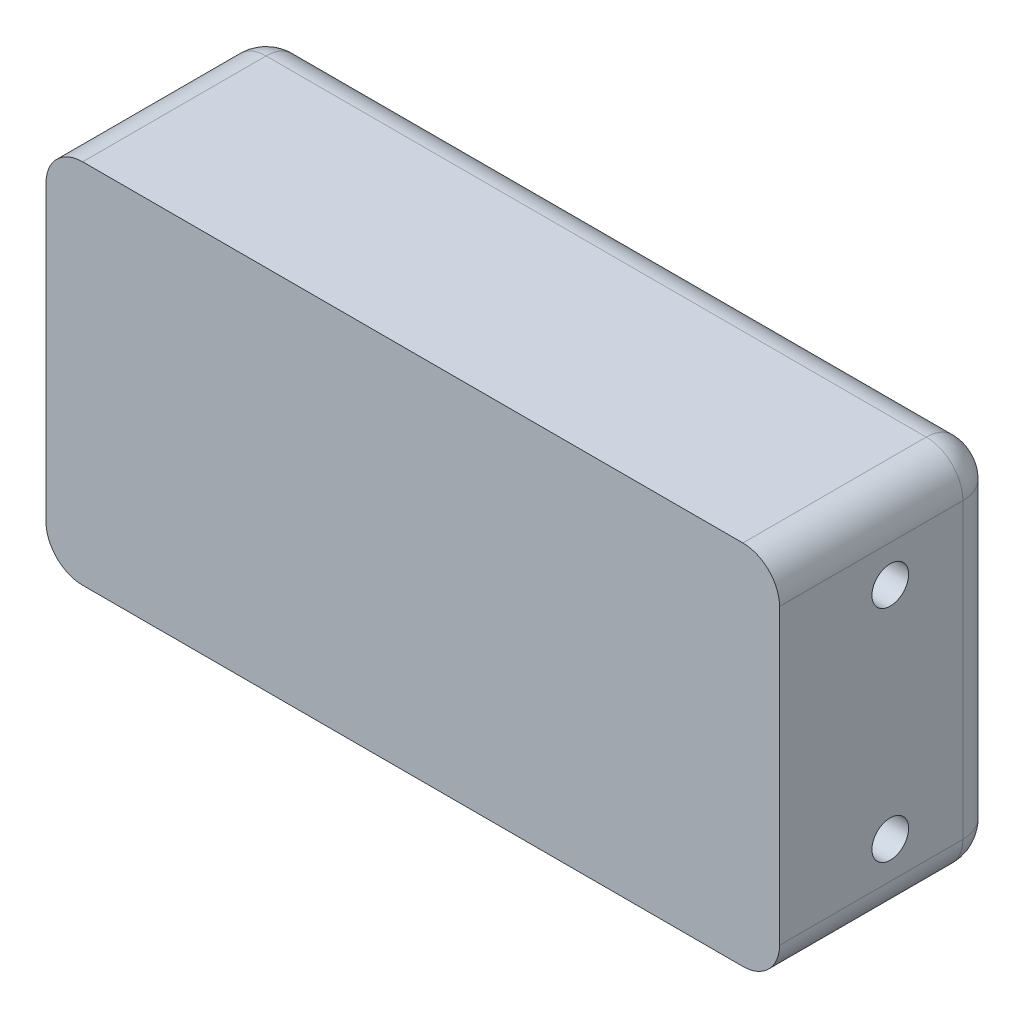
from build123d import *

# Parameters (mm, degrees)
SKETCH1_W               = 100
SKETCH1_H               = 50
BOSS_EXTRUDE1_DEPTH     = 30
SKETCH2_R               = 2.5
CUT_EXTRUDE1_DEPTH      = 108.354552768
FILLET1_R               = 5
CUT_EXTRUDE2_REACH      = 65.443
CUT_EXTRUDE2_END_RADIUS = 2.5
SKETCH3_R               = 2.5
FILLET2_R               = 5


with BuildPart() as part:
    # Sketch1 → Boss-Extrude1 (new body)
    with BuildSketch(Plane.XY):
        Rectangle(SKETCH1_W, SKETCH1_H)
    extrude(amount=BOSS_EXTRUDE1_DEPTH)

    # Sketch2 → Cut-Extrude1 (cut, through all)
    with BuildSketch(Plane(origin=(50, 0, 0), x_dir=(0, 0, -1), z_dir=(1, 0, 0))):
        with Locations(Location((-14.903548917, 15, 0), (0, 0, 90))):
            Circle(SKETCH2_R)
        with Locations(Location((-14.903548917, -15, 0), (0, 0, 90))):
            Circle(SKETCH2_R)
    extrude(amount=-CUT_EXTRUDE1_DEPTH, mode=Mode.SUBTRACT)

    # Fillet1
    fillet1_edges = [part.edges().sort_by_distance(p)[0] for p in [
        (0, -25, 0),
        (-50, 0, 0),
        (0, 25, 0),
        (50, 0, 0),
    ]]
    fillet(fillet1_edges, radius=FILLET1_R)

    # Cut-Extrude2: up to this cylinder (the profile starts outside it)
    cut_extrude2_end = Plane(origin=(0, 15, 14.903548917), z_dir=(1, 0, 0)) * Cylinder(CUT_EXTRUDE2_END_RADIUS, 196.886, mode=Mode.PRIVATE)
    # Sketch3 → Cut-Extrude2 (cut, up to the surface)
    with BuildSketch(Plane(origin=(0, 0, 0), x_dir=(-1, 0, 0), z_dir=(0, 0, -1)), mode=Mode.PRIVATE) as cut_extrude2_sk1:
        with Locations((-30, 15)):
            Circle(SKETCH3_R)
    cut_extrude2_tool1 = extrude(cut_extrude2_sk1.sketch, amount=-CUT_EXTRUDE2_REACH, mode=Mode.PRIVATE) - cut_extrude2_end
    add(cut_extrude2_tool1.solids().sort_by_distance((30, 15, 0))[0], mode=Mode.SUBTRACT)
    # Sketch3 → Cut-Extrude2 (cut, up to the surface)
    with BuildSketch(Plane(origin=(0, 0, 0), x_dir=(-1, 0, 0), z_dir=(0, 0, -1)), mode=Mode.PRIVATE) as cut_extrude2_sk2:
        with Locations((30, 15)):
            Circle(SKETCH3_R)
    cut_extrude2_tool2 = extrude(cut_extrude2_sk2.sketch, amount=-CUT_EXTRUDE2_REACH, mode=Mode.PRIVATE) - cut_extrude2_end
    add(cut_extrude2_tool2.solids().sort_by_distance((-30, 15, 0))[0], mode=Mode.SUBTRACT)
    # Sketch3 → Cut-Extrude2 (cut, up to the surface)
    with BuildSketch(Plane(origin=(0, 0, 0), x_dir=(-1, 0, 0), z_dir=(0, 0, -1)), mode=Mode.PRIVATE) as cut_extrude2_sk3:
        with Locations((0, 15)):
            Circle(SKETCH3_R)
    cut_extrude2_tool3 = extrude(cut_extrude2_sk3.sketch, amount=-CUT_EXTRUDE2_REACH, mode=Mode.PRIVATE) - cut_extrude2_end
    add(cut_extrude2_tool3.solids().sort_by_distance((0, 15, 0))[0], mode=Mode.SUBTRACT)

    # Fillet2
    # the kernel refuses this fillet: 5 mm, written as the material it takes off along each edge
    with BuildSketch(Plane(origin=(-45, -20, 5), x_dir=(0, -1, 0), z_dir=(-1, 0, 0))) as fillet2_piece_1_section:
        Polygon((0, 0), (FILLET2_R, 0), (FILLET2_R, -FILLET2_R), (0, -FILLET2_R), align=None)
    fillet2_piece_1 = extrude(amount=FILLET2_R, mode=Mode.PRIVATE)
    fillet2_piece_1 = fillet2_piece_1 - Plane(origin=(-45, -20, 5), x_dir=(0, 0.7071067811865475, 0.7071067811865475), z_dir=(-1, 0, 0)) * Sphere(FILLET2_R, mode=Mode.PRIVATE)
    add(fillet2_piece_1, mode=Mode.SUBTRACT)
    with BuildSketch(Plane(origin=(-45, 20, 5), x_dir=(-1, 0, 0), z_dir=(0, 1, 0))) as fillet2_piece_2_section:
        Polygon((0, 0), (FILLET2_R, 0), (FILLET2_R, -FILLET2_R), (0, -FILLET2_R), align=None)
    fillet2_piece_2 = extrude(amount=FILLET2_R, mode=Mode.PRIVATE)
    fillet2_piece_2 = fillet2_piece_2 - Plane(origin=(-45, 20, 5), x_dir=(0.7071067811865475, 0, 0.7071067811865475), z_dir=(0, 1, 0)) * Sphere(FILLET2_R, mode=Mode.PRIVATE)
    add(fillet2_piece_2, mode=Mode.SUBTRACT)
    with BuildSketch(Plane(origin=(45, -20, 5), x_dir=(0, -1, 0), z_dir=(1, 0, 0))) as fillet2_piece_3_section:
        Polygon((0, 0), (FILLET2_R, 0), (FILLET2_R, FILLET2_R), (0, FILLET2_R), align=None)
    fillet2_piece_3 = extrude(amount=FILLET2_R, mode=Mode.PRIVATE)
    fillet2_piece_3 = fillet2_piece_3 - Plane(origin=(45, -20, 5), x_dir=(0, 0.7071067811865475, 0.7071067811865475), z_dir=(1, 0, 0)) * Sphere(FILLET2_R, mode=Mode.PRIVATE)
    add(fillet2_piece_3, mode=Mode.SUBTRACT)
    with BuildSketch(Plane(origin=(45, 20, 5), x_dir=(1, 0, 0), z_dir=(0, 1, 0))) as fillet2_piece_4_section:
        Polygon((0, 0), (FILLET2_R, 0), (FILLET2_R, FILLET2_R), (0, FILLET2_R), align=None)
    fillet2_piece_4 = extrude(amount=FILLET2_R, mode=Mode.PRIVATE)
    fillet2_piece_4 = fillet2_piece_4 - Plane(origin=(45, 20, 5), x_dir=(-0.7071067811865475, 0, 0.7071067811865475), z_dir=(0, 1, 0)) * Sphere(FILLET2_R, mode=Mode.PRIVATE)
    add(fillet2_piece_4, mode=Mode.SUBTRACT)
    with BuildSketch(Plane(origin=(50, -25, 5), x_dir=(0, 1, 0), z_dir=(0, 0, 1)), Plane(origin=(50, 25, 5), x_dir=(-1, 0, 0), z_dir=(0, 0, 1))) as fillet2_piece_5:
        with BuildLine():
            CenterArc((FILLET2_R, FILLET2_R), FILLET2_R, 180, 90)
            Line((0, FILLET2_R), (0, 0))
            Line((0, 0), (FILLET2_R, 0))
        make_face()
    extrude(amount=37.5, mode=Mode.SUBTRACT)
    with BuildSketch(Plane(origin=(-50, -25, 5), x_dir=(0, 1, 0), z_dir=(0, 0, 1)), Plane(origin=(-50, 25, 5), x_dir=(1, 0, 0), z_dir=(0, 0, 1))) as fillet2_piece_6:
        with BuildLine():
            CenterArc((FILLET2_R, -FILLET2_R), FILLET2_R, 90, 90)
            Line((0, -FILLET2_R), (0, 0))
            Line((0, 0), (FILLET2_R, 0))
        make_face()
    extrude(amount=37.5, mode=Mode.SUBTRACT)


solid = part.part
